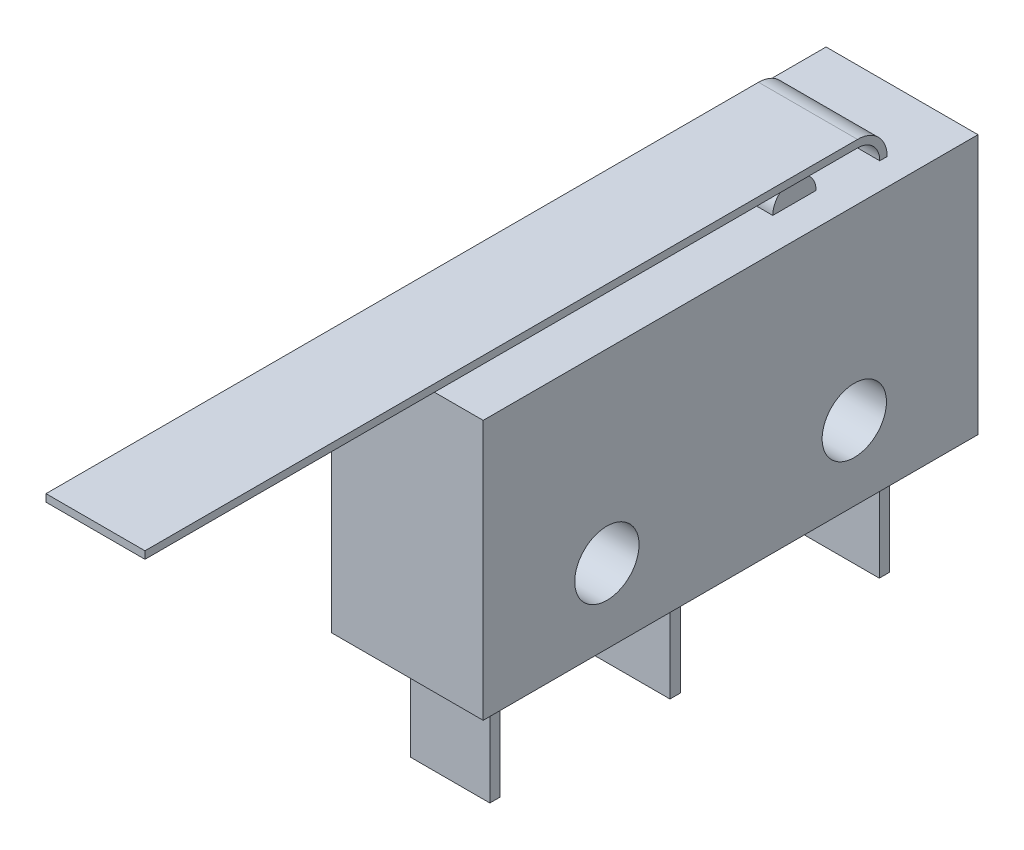
from build123d import *

# Parameters (mm, degrees)
SKETCH1_W           = 20
SKETCH1_H           = 10.5
SKETCH1_R           = 1.3
BOSS_EXTRUDE1_DEPTH = 6.14
BOSS_EXTRUDE2_DEPTH = 2
BOSS_EXTRUDE5_DEPTH = 1.75
SKETCH4_W           = 0.42
SKETCH4_H           = 4.5
BOSS_EXTRUDE6_DEPTH = 1.6


with BuildPart() as part:
    # Sketch1 → Boss-Extrude1 (new body)
    with BuildSketch(Plane(origin=(0, 0, 0), x_dir=(0, 0, -1), z_dir=(1, 0, 0))):
        with Locations((10, -5.25)):
            Rectangle(SKETCH1_W, SKETCH1_H)
        with Locations((5, -7.5)):
            Circle(SKETCH1_R, mode=Mode.SUBTRACT)
        with Locations((15, -7.5)):
            Circle(SKETCH1_R, mode=Mode.SUBTRACT)
    extrude(amount=BOSS_EXTRUDE1_DEPTH)

    # Sketch2 → Boss-Extrude2 (add, symmetric)
    with BuildSketch(Plane(origin=(3.07, 0, 0), x_dir=(0, 0, -1), z_dir=(1, 0, 0))):
        with BuildLine():
            Line((16.2, 0.9), (-12.6, 0.9))
            Line((-12.6, 0.9), (-12.6, 1.2))
            Line((-12.6, 1.2), (16.2, 1.2))
            ThreePointArc((16.2, 1.2), (17.048528137, 0.848528137), (17.4, 0))
            Line((17.4, 0), (17.1, 0))
            ThreePointArc((17.1, 0), (16.836396103, 0.636396103), (16.2, 0.9))
        make_face()
    extrude(amount=BOSS_EXTRUDE2_DEPTH, both=True)

    # Sketch3 → Boss-Extrude5 (add, symmetric)
    with BuildSketch(Plane(origin=(3.07, 0, 0), x_dir=(0, 0, -1), z_dir=(1, 0, 0))):
        with BuildLine():
            Line((13.025, 0), (14.775, 0))
            ThreePointArc((14.775, 0), (13.9, 0.875), (13.025, 0))
        make_face()
    extrude(amount=BOSS_EXTRUDE5_DEPTH, both=True)

    # Sketch4 → Boss-Extrude6 (add, symmetric)
    with BuildSketch(Plane(origin=(3.07, 0, 0), x_dir=(0, 0, -1), z_dir=(1, 0, 0))):
        with Locations((1.95, -12.75)):
            Rectangle(SKETCH4_W, SKETCH4_H)
        with Locations((9.23, -12.75)):
            Rectangle(SKETCH4_W, SKETCH4_H)
        with Locations((17.69, -12.75)):
            Rectangle(SKETCH4_W, SKETCH4_H)
    extrude(amount=BOSS_EXTRUDE6_DEPTH, both=True)


solid = part.part
